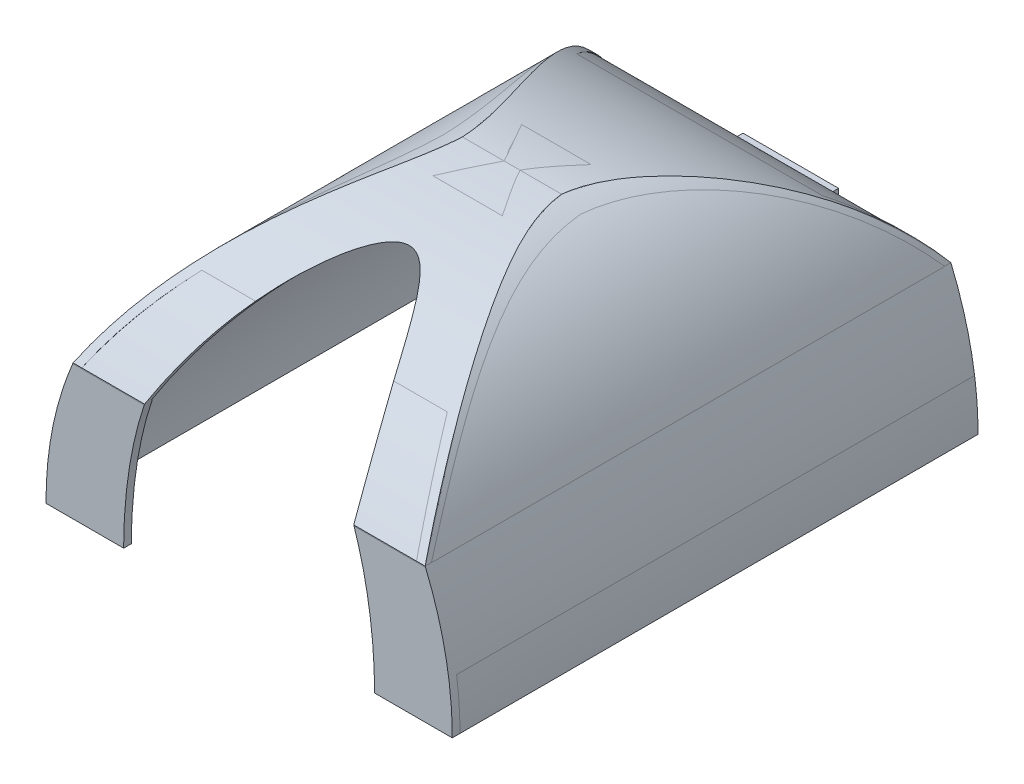
from build123d import *
from OCP.BRepAlgoAPI import BRepAlgoAPI_Cut
from OCP.TopTools import TopTools_ListOfShape

# Parameters (mm, degrees)
BOSS_EXTRUDE1_DEPTH      = 165
BOSS_EXTRUDE3_DEPTH      = 2
CUT_EXTRUDE2_DEPTH       = 197.25000016
CUT_EXTRUDE2_DEPTH_BACK  = 197.25000016
BOSS_EXTRUDE4_START      = -5
SKETCH7_W                = 30
SKETCH7_H                = 40
BOSS_EXTRUDE4_DEPTH      = 10
CUT_EXTRUDE3_DEPTH       = 197.25000016
CUT_EXTRUDE3_DEPTH_BACK  = 197.25000016
SKETCH8_W                = 24
SKETCH8_H                = 37
BOSS_EXTRUDE5_START      = 70
BOSS_EXTRUDE5_DEPTH      = 140
CUT_EXTRUDE9_DEPTH       = 199.368360006
CUT_EXTRUDE9_DEPTH_BACK  = 199.368360006
CUT_EXTRUDE10_DEPTH      = 198.280792869
CUT_EXTRUDE10_DEPTH_BACK = 198.280792869
CUT_EXTRUDE11_START      = 100
SKETCH17_W               = 30
SKETCH17_H               = 70
CUT_EXTRUDE11_DEPTH      = 140
BOSS_EXTRUDE6_START      = -70
SKETCH18_W               = 2.43
SKETCH18_H               = 42.429971898
BOSS_EXTRUDE6_DEPTH      = 140
CUT_EXTRUDE12_START      = 100
SKETCH19_W               = 30
SKETCH19_H               = 70
CUT_EXTRUDE12_DEPTH      = 140
CUT_EXTRUDE13_DEPTH      = 198.280792656
CUT_EXTRUDE13_DEPTH_BACK = 198.280792656
CUT_EXTRUDE18_START      = 80
SKETCH22_RX              = 76.839019905
SKETCH22_RY              = 39.375
CUT_EXTRUDE18_DEPTH      = 140


with BuildPart() as part:
    # Sketch1 → Boss-Extrude1 (new body)
    with BuildSketch(Plane.XY):
        with BuildLine():
            add(Edge.make_bspline(
                [(0, 85), (-63.75, 85), (-63.75, 0)],
                knots=[0, 0, 0, 1.570796327, 1.570796327, 1.570796327], degree=2, weights=[1, 0.707106781, 1]))
            Line((-63.75, 0), (-61.25, 0))
            add(Edge.make_bspline(
                [(0, 82.5), (-61.25, 82.5), (-61.25, 0)],
                knots=[0, 0, 0, 1.570796327, 1.570796327, 1.570796327], degree=2, weights=[1, 0.707106781, 1]))
            add(Edge.make_bspline(
                [(61.25, 0), (61.25, 82.5), (0, 82.5)],
                knots=[4.71238898, 4.71238898, 4.71238898, 6.283185307, 6.283185307, 6.283185307], degree=2, weights=[1, 0.707106781, 1]))
            Line((61.25, 0), (63.75, 0))
            add(Edge.make_bspline(
                [(63.75, 0), (63.75, 85), (0, 85)],
                knots=[4.71238898, 4.71238898, 4.71238898, 6.283185307, 6.283185307, 6.283185307], degree=2, weights=[1, 0.707106781, 1]))
        make_face()
    extrude(amount=BOSS_EXTRUDE1_DEPTH)

    # Sketch4 → Boss-Extrude3 (add)
    with BuildSketch(Plane.XY):
        with BuildLine():
            Line((-63.75, 9.511821538), (-63.75, 0))
            Line((-63.75, 0), (-58.036694073, 0))
            ThreePointArc((-58.036694073, 0), (-52.652964834, 3.698299818), (-46.252375901, 5))
            Line((-46.252375901, 5), (-31.252375901, 5))
            ThreePointArc((-31.252375901, 5), (-24.851786968, 3.698299818), (-19.46805773, 0))
            Line((-19.46805773, 0), (19.46805773, 0))
            ThreePointArc((19.46805773, 0), (24.851786968, 3.698299818), (31.252375901, 5))
            Line((31.252375901, 5), (46.252375901, 5))
            ThreePointArc((46.252375901, 5), (52.652964834, 3.698299818), (58.036694073, 0))
            Line((58.036694073, 0), (63.505468004, 0))
            Line((63.505468004, 0), (63.505468004, 84.859937985))
            Line((63.505468004, 84.859937985), (-63.75, 84.859937985))
            Line((-63.75, 84.859937985), (-63.75, 9.511821538))
        make_face()
    extrude(amount=BOSS_EXTRUDE3_DEPTH)

    # Sketch5 → Cut-Extrude2 (cut, two sides: drawn at the far end of the back side and taken through both)
    with BuildSketch(Plane.XY.offset(-CUT_EXTRUDE2_DEPTH_BACK)):
        with BuildLine():
            Line((65.571813586, 87.339469953), (-65.159044278, 87.339469953))
            Line((-65.159044278, 87.339469953), (-65.159044278, 0))
            Line((-65.159044278, 0), (-63.75, 0))
            add(Edge.make_bspline(
                [(0, 85), (-63.75, 85), (-63.75, 0)],
                knots=[0, 0, 0, 1.570796327, 1.570796327, 1.570796327], degree=2, weights=[1, 0.707106781, 1]))
            add(Edge.make_bspline(
                [(63.75, 0), (63.75, 85), (0, 85)],
                knots=[4.71238898, 4.71238898, 4.71238898, 6.283185307, 6.283185307, 6.283185307], degree=2, weights=[1, 0.707106781, 1]))
            Line((63.75, 0), (65.571813586, 0))
            Line((65.571813586, 0), (65.571813586, 87.339469953))
        make_face()
    extrude(amount=CUT_EXTRUDE2_DEPTH + CUT_EXTRUDE2_DEPTH_BACK, mode=Mode.SUBTRACT)

    # Sketch7 → Boss-Extrude4 (add)
    with BuildSketch(Plane.XY.offset(BOSS_EXTRUDE4_START)):
        with Locations((0, 20)):
            Rectangle(SKETCH7_W, SKETCH7_H)
    extrude(amount=BOSS_EXTRUDE4_DEPTH)

    # Sketch8 → Cut-Extrude3 (cut, two sides: drawn at the far end of the back side and taken through both)
    with BuildSketch(Plane.XY.offset(-CUT_EXTRUDE3_DEPTH_BACK)):
        with Locations((0, 18.5)):
            Rectangle(SKETCH8_W, SKETCH8_H)
    extrude(amount=CUT_EXTRUDE3_DEPTH + CUT_EXTRUDE3_DEPTH_BACK, mode=Mode.SUBTRACT)

    # Sketch13 → Boss-Extrude5 (add)
    with BuildSketch(Plane(origin=(0, 0, 0), x_dir=(0, 0, -1), z_dir=(1, 0, 0)).offset(BOSS_EXTRUDE5_START)):
        with BuildLine():
            Line((1.875e-05, 42.429968995), (0, 40))
            add(Edge.make_bspline(
                [(0, 40), (-30.548887353, 78.366895266), (-82.5, 80)],
                knots=[0, 0, 0, 1, 1, 1], degree=2))
            add(Edge.make_bspline(
                [(-165, 40), (-134.451112647, 78.366895266), (-82.5, 80)],
                knots=[0, 0, 0, 1, 1, 1], degree=2))
            Line((-165, 40), (-165.00001875, 42.429968995))
            add(Edge.make_bspline(
                [(-165.00001875, 42.429968995), (-133.43441016, 80.544595149), (-82.5, 82.43)],
                knots=[0, 0, 0, 1, 1, 1], degree=2))
            add(Edge.make_bspline(
                [(1.875e-05, 42.429968995), (-31.56558984, 80.544595149), (-82.5, 82.43)],
                knots=[0, 0, 0, 1, 1, 1], degree=2))
        make_face()
    extrude(amount=-BOSS_EXTRUDE5_DEPTH)

    # Sketch15 → Cut-Extrude9 (cut, two sides: drawn at the far end of the back side and taken through both)
    with BuildSketch(Plane(origin=(0, 0, 0), x_dir=(0, 0, -1), z_dir=(1, 0, 0)).offset(-CUT_EXTRUDE9_DEPTH_BACK)):
        with BuildLine():
            Line((1.875e-05, 42.429968995), (1.875e-05, 100.728949135))
            Line((1.875e-05, 100.728949135), (-165.00001875, 100.728949135))
            Line((-165.00001875, 100.728949135), (-165.00001875, 42.429968995))
            add(Edge.make_bspline(
                [(-165.00001875, 42.429968995), (-145.635551474, 67.428934654), (-113.756093402, 81.600920734), (-82.5, 82.43)],
                knots=[0, 0, 0, 0, 1, 1, 1, 1], degree=3))
            add(Edge.make_bspline(
                [(1.875e-05, 42.429968995), (-19.364448526, 67.428934654), (-51.243906598, 81.600920734), (-82.5, 82.43)],
                knots=[0, 0, 0, 0, 1, 1, 1, 1], degree=3))
        make_face()
    extrude(amount=CUT_EXTRUDE9_DEPTH + CUT_EXTRUDE9_DEPTH_BACK, mode=Mode.SUBTRACT)

    # Sketch16 → Cut-Extrude10 (cut, two sides: drawn at the far end of the back side and taken through both)
    with BuildSketch(Plane.XY.offset(-CUT_EXTRUDE10_DEPTH_BACK)):
        with BuildLine():
            Line((-90.3827785, 0), (-63.75, 0))
            add(Edge.make_bspline(
                [(0, 85.005862895), (-63.75, 85.005862895), (-63.75, 0)],
                knots=[0, 0, 0, 1.570796327, 1.570796327, 1.570796327], degree=2, weights=[1, 0.707106781, 1]))
            add(Edge.make_bspline(
                [(63.75, 0), (63.75, 85.005862895), (0, 85.005862895)],
                knots=[4.71238898, 4.71238898, 4.71238898, 6.283185307, 6.283185307, 6.283185307], degree=2, weights=[1, 0.707106781, 1]))
            Line((63.75, 0), (83.739603028, 0))
            Line((83.739603028, 0), (83.739603028, 92.208443309))
            Line((83.739603028, 92.208443309), (-90.3827785, 92.208443309))
            Line((-90.3827785, 92.208443309), (-90.3827785, 0))
        make_face()
    extrude(amount=CUT_EXTRUDE10_DEPTH + CUT_EXTRUDE10_DEPTH_BACK, mode=Mode.SUBTRACT)

    # Sketch17 → Cut-Extrude11 (cut)
    with BuildSketch(Plane.XY.offset(CUT_EXTRUDE11_START)):
        with Locations((0, 35)):
            Rectangle(SKETCH17_W, SKETCH17_H)
    extrude(amount=CUT_EXTRUDE11_DEPTH, mode=Mode.SUBTRACT)

    # Sketch18 → Boss-Extrude6 (add)
    with BuildSketch(Plane(origin=(0, 0, 0), x_dir=(0, 0, -1), z_dir=(1, 0, 0)).offset(BOSS_EXTRUDE6_START)):
        with Locations((-163.785016501, 21.214985949)):
            Rectangle(SKETCH18_W, SKETCH18_H)
    extrude(amount=BOSS_EXTRUDE6_DEPTH)

    # Sketch19 → Cut-Extrude12 (cut)
    with BuildSketch(Plane.XY.offset(CUT_EXTRUDE12_START)):
        with Locations((0, 35)):
            Rectangle(SKETCH19_W, SKETCH19_H)
    extrude(amount=CUT_EXTRUDE12_DEPTH, mode=Mode.SUBTRACT)


with BuildPart() as cut_extrude13_tool:
    # Sketch20 → Cut-Extrude13 (new, two sides: drawn at the far end of the back side and taken through both)
    with BuildSketch(Plane.XY.offset(-CUT_EXTRUDE13_DEPTH_BACK)):
        with BuildLine():
            Line((55.24010658, 42.429975164), (74.42062351, 42.429975164))
            Line((74.42062351, 42.429975164), (74.42062351, 0))
            Line((74.42062351, 0), (63.75, 0))
            add(Edge.make_bspline(
                [(63.75, 0), (63.788917751, 21.947758031), (55.24010658, 42.429975164)],
                knots=[0, 0, 0, 1, 1, 1], degree=2))
        make_face()
        with BuildLine():
            Line((-63.75, 0), (-76.084499239, 0))
            Line((-76.084499239, 0), (-76.084499239, 44.492005071))
            Line((-76.084499239, 44.492005071), (-55.240125873, 42.429975046))
            add(Edge.make_bspline(
                [(-55.240125873, 42.429975046), (-63.812697591, 22.250920257), (-63.75, 0)],
                knots=[0, 0, 0, 1, 1, 1], degree=2))
        make_face()
    extrude(amount=CUT_EXTRUDE13_DEPTH + CUT_EXTRUDE13_DEPTH_BACK)


with BuildPart() as part_1:
    add(part.part)

    # Cut-Extrude13: cut by cut_extrude13_tool, with a tolerance
    cut_extrude13_stock = TopTools_ListOfShape()
    cut_extrude13_stock.Append(part_1.part.wrapped)
    cut_extrude13_tools = TopTools_ListOfShape()
    cut_extrude13_tools.Append(cut_extrude13_tool.part.wrapped)
    cut_extrude13_cut = BRepAlgoAPI_Cut()
    cut_extrude13_cut.SetArguments(cut_extrude13_stock)
    cut_extrude13_cut.SetTools(cut_extrude13_tools)
    cut_extrude13_cut.SetFuzzyValue(0.00001)
    cut_extrude13_cut.Build()
    add(Compound.cast(cut_extrude13_cut.Shape()).solids(), mode=Mode.REPLACE)

    # Sketch22 → Cut-Extrude18 (cut)
    with BuildSketch(Plane.XY.offset(CUT_EXTRUDE18_START)):
        with Locations(Location((0, 0), (0, 0, 90))):
            Ellipse(SKETCH22_RX, SKETCH22_RY)
    extrude(amount=CUT_EXTRUDE18_DEPTH, mode=Mode.SUBTRACT)


solid = part_1.part
